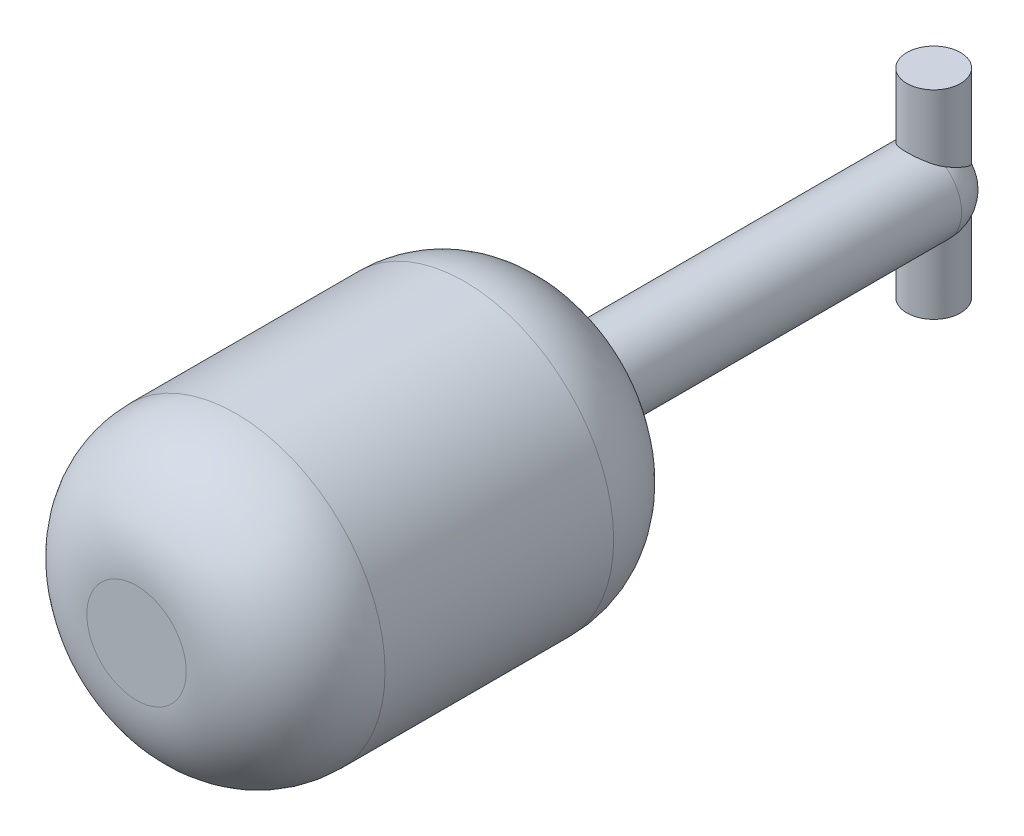
from build123d import *

# Parameters (mm, degrees)
SKETCH1_R                = 4
BOSS_EXTRUDE1_DEPTH      = 40
BOSS_EXTRUDE2_START      = 40
SKETCH1_3_R              = 15
SKETCH1_3_R_2            = 12
BOSS_EXTRUDE2_DEPTH      = 40
BOSS_EXTRUDE3_START      = 40
SKETCH1_4_R              = 12
SKETCH1_4_R_2            = 4
BOSS_EXTRUDE3_DEPTH      = 3
FILLET1_R                = 10
FILLET2_R                = 10
BOSS_EXTRUDE4_START      = 80
SKETCH1_5_R              = 15
SKETCH1_5_R_2            = 12
SKETCH1_5_R_3            = 4
BOSS_EXTRUDE4_DEPTH      = 3
FILLET5_R                = 10
FILLET6_R                = 10
BOSS_EXTRUDE5_DEPTH      = 10
BOSS_EXTRUDE5_DEPTH_BACK = 10
SKETCH2_R                = 2.7
FILLET7_R                = 4


with BuildPart() as part:
    # Sketch1 → Boss-Extrude1 (new body)
    with BuildSketch(Plane.XY):
        Circle(SKETCH1_R)
    extrude(amount=BOSS_EXTRUDE1_DEPTH)

    # Sketch2 → Boss-Extrude5 (add, two sides: drawn at the far end of the back side and taken through both)
    with BuildSketch(Plane(origin=(0, 0, 0), x_dir=(1, 0, 0), z_dir=(0, 1, 0)).offset(-BOSS_EXTRUDE5_DEPTH_BACK)):
        with Locations(Location((0, -2.8, 0), (0, 0, 270))):
            Circle(SKETCH2_R)
    extrude(amount=BOSS_EXTRUDE5_DEPTH + BOSS_EXTRUDE5_DEPTH_BACK)

    # Fillet7
    # the kernel refuses this fillet: 4 mm, written as the material it takes off along each edge
    with BuildSketch(Plane(origin=(0, 0, 0), x_dir=(1, 0, 0), z_dir=(0, -1, 0))) as fillet7_piece_1_section:
        with BuildLine():
            CenterArc((4 - FILLET7_R, FILLET7_R), FILLET7_R, 270, 90)
            Line((4 - FILLET7_R, 0), (4, 0))
            Line((4, 0), (4, FILLET7_R))
        make_face()
    fillet7_piece_1 = revolve(axis=Axis((0, 0, 0), (0, 0, 1)), mode=Mode.PRIVATE)
    fillet7_piece_1 = fillet7_piece_1 - Plane(origin=(0, 0, 2.8), x_dir=(0, 0, 1), z_dir=(0, -1, 0)) * Cylinder(2.7, 16, mode=Mode.PRIVATE)
    add(fillet7_piece_1, mode=Mode.SUBTRACT)


with BuildPart() as body_2:
    # Sketch1<3> → Boss-Extrude2 (new body)
    with BuildSketch(Plane.XY.offset(BOSS_EXTRUDE2_START)):
        Circle(SKETCH1_3_R)
        Circle(SKETCH1_3_R_2, mode=Mode.SUBTRACT)
    extrude(amount=BOSS_EXTRUDE2_DEPTH)

    # Sketch1<4> → Boss-Extrude3 (add)
    # profile 1 of 2: a face of its own
    with BuildSketch(Plane.XY.offset(BOSS_EXTRUDE3_START)):
        Circle(SKETCH1_4_R)
        Circle(SKETCH1_4_R_2, mode=Mode.SUBTRACT)
    # profile 2 of 2: a face of its own
    with BuildSketch(Plane.XY.offset(BOSS_EXTRUDE3_START)):
        Circle(SKETCH1_4_R_2)
    extrude(amount=BOSS_EXTRUDE3_DEPTH)

    # Fillet1
    fillet1_edges = [body_2.edges().sort_by_distance(p)[0] for p in [
        (-15, 0, 40),
    ]]
    fillet(fillet1_edges, radius=FILLET1_R)

    # Fillet2
    fillet2_edges = [body_2.edges().sort_by_distance(p)[0] for p in [
        (-12, 0, 43),
    ]]
    fillet(fillet2_edges, radius=FILLET2_R)

    # Sketch1<5> → Boss-Extrude4 (add)
    # profile 1 of 3: a face of its own
    with BuildSketch(Plane.XY.offset(BOSS_EXTRUDE4_START)):
        Circle(SKETCH1_5_R)
        Circle(SKETCH1_5_R_2, mode=Mode.SUBTRACT)
    # profile 2 of 3: a face of its own
    with BuildSketch(Plane.XY.offset(BOSS_EXTRUDE4_START)):
        Circle(SKETCH1_5_R_2)
        Circle(SKETCH1_5_R_3, mode=Mode.SUBTRACT)
    # profile 3 of 3: a face of its own
    with BuildSketch(Plane.XY.offset(BOSS_EXTRUDE4_START)):
        Circle(SKETCH1_5_R_3)
    extrude(amount=BOSS_EXTRUDE4_DEPTH)

    # Fillet5
    fillet5_edges = [body_2.edges().sort_by_distance(p)[0] for p in [
        (-12, 0, 80),
    ]]
    fillet(fillet5_edges, radius=FILLET5_R)

    # Fillet6
    fillet6_edges = [body_2.edges().sort_by_distance(p)[0] for p in [
        (-15, 0, 83),
    ]]
    fillet(fillet6_edges, radius=FILLET6_R)


solid = Compound([part.part, body_2.part])
